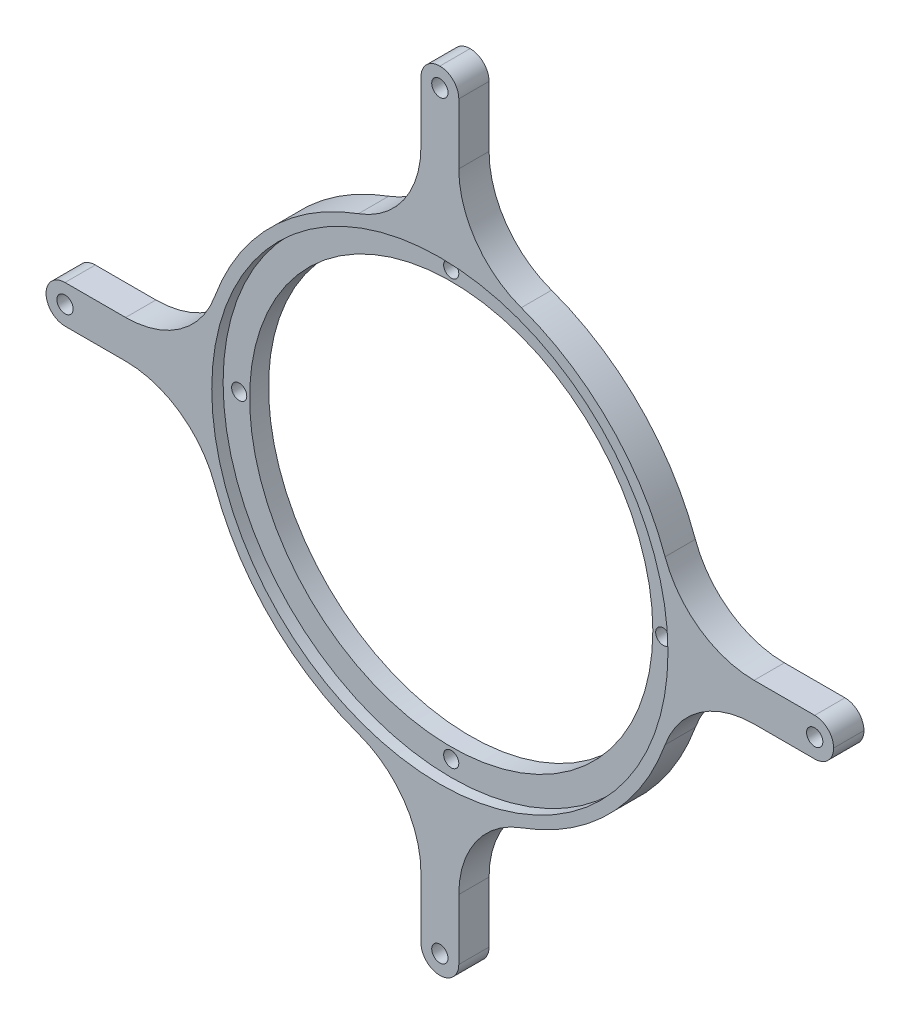
from build123d import *

# Parameters (mm, degrees)
CROQUIS1_R              = 60.25
CROQUIS1_R_2            = 2
CROQUIS1_R_3            = 53.25
SALIENTE_EXTRUIR1_DEPTH = 5
CROQUIS1_2_R            = 63.25
CROQUIS1_2_R_2          = 60.25
EXTRUIR_L_MINA1_DEPTH   = 8
CROQUIS2_W              = 10
CROQUIS2_H              = 40.947938178
CROQUIS2_R              = 1.25
CROQUIS2_W_2            = 40.947938178
CROQUIS2_H_2            = 10
SALIENTE_EXTRUIR2_DEPTH = 8
REDONDEO1_R             = 25
CROQUIS3_R              = 2.15
CORTAR_EXTRUIR1_DEPTH   = 5
REDONDEO2_R             = 5


with BuildPart() as part:
    # Croquis1 → Saliente-Extruir1 (new body)
    with BuildSketch(Plane.XY):
        Circle(CROQUIS1_R)
        with Locations((0, 56)):
            Circle(CROQUIS1_R_2, mode=Mode.SUBTRACT)
        Circle(CROQUIS1_R_3, mode=Mode.SUBTRACT)
        with Locations((56, 0)):
            Circle(CROQUIS1_R_2, mode=Mode.SUBTRACT)
        with Locations((0, -56)):
            Circle(CROQUIS1_R_2, mode=Mode.SUBTRACT)
        with Locations((-56, 0)):
            Circle(CROQUIS1_R_2, mode=Mode.SUBTRACT)
    extrude(amount=SALIENTE_EXTRUIR1_DEPTH)

    # Croquis1<2> → Extruir-Lámina1 (add)
    with BuildSketch(Plane.XY):
        Circle(CROQUIS1_2_R)
        Circle(CROQUIS1_2_R_2, mode=Mode.SUBTRACT)
    extrude(amount=EXTRUIR_L_MINA1_DEPTH)

    # Croquis2 → Saliente-Extruir2 (add)
    # profile 1 of 4: a face of its own
    with BuildSketch(Plane.XY):
        with Locations((0, 83.526030911)):
            Rectangle(CROQUIS2_W, CROQUIS2_H)
        with Locations((0, 99)):
            Circle(CROQUIS2_R, mode=Mode.SUBTRACT)
    # profile 2 of 4: a face of its own
    with BuildSketch(Plane.XY):
        with Locations((83.526030911, 0)):
            Rectangle(CROQUIS2_W_2, CROQUIS2_H_2)
        with Locations((99, 0)):
            Circle(CROQUIS2_R, mode=Mode.SUBTRACT)
    # profile 3 of 4: a face of its own
    with BuildSketch(Plane.XY):
        with Locations((0, -83.526030911)):
            Rectangle(CROQUIS2_W, CROQUIS2_H)
        with Locations((0, -99)):
            Circle(CROQUIS2_R, mode=Mode.SUBTRACT)
    # profile 4 of 4: a face of its own
    with BuildSketch(Plane.XY):
        with Locations((-83.526030911, 0)):
            Rectangle(CROQUIS2_W_2, CROQUIS2_H_2)
        with Locations((-99, 0)):
            Circle(CROQUIS2_R, mode=Mode.SUBTRACT)
    extrude(amount=SALIENTE_EXTRUIR2_DEPTH)

    # Redondeo1
    redondeo1_edges = [part.edges().sort_by_distance(p)[0] for p in [
        (-5, 63.052061822, 4),
        (5, 63.052061822, 4),
        (63.052061822, 5, 4),
        (63.052061822, -5, 4),
        (5, -63.052061822, 4),
        (-5, -63.052061822, 4),
        (-63.052061822, -5, 4),
        (-63.052061822, 5, 4),
    ]]
    fillet(redondeo1_edges, radius=REDONDEO1_R)

    # Croquis3 → Cortar-Extruir1 (cut)
    with BuildSketch(Plane.XY.offset(8)):
        with Locations((0, 99)):
            Circle(CROQUIS3_R)
        with Locations((99, 0)):
            Circle(CROQUIS3_R)
        with Locations((0, -99)):
            Circle(CROQUIS3_R)
        with Locations((-99, 0)):
            Circle(CROQUIS3_R)
    extrude(amount=-CORTAR_EXTRUIR1_DEPTH, mode=Mode.SUBTRACT)

    # Redondeo2
    redondeo2_edges = [part.edges().sort_by_distance(p)[0] for p in [
        (-104, -5, 4),
        (-104, 5, 4),
        (-5, -104, 4),
        (5, -104, 4),
        (104, -5, 4),
        (104, 5, 4),
        (5, 104, 4),
        (-5, 104, 4),
    ]]
    fillet(redondeo2_edges, radius=REDONDEO2_R - 0.0001)  # a hair under: the kernel refuses the full size


solid = part.part
